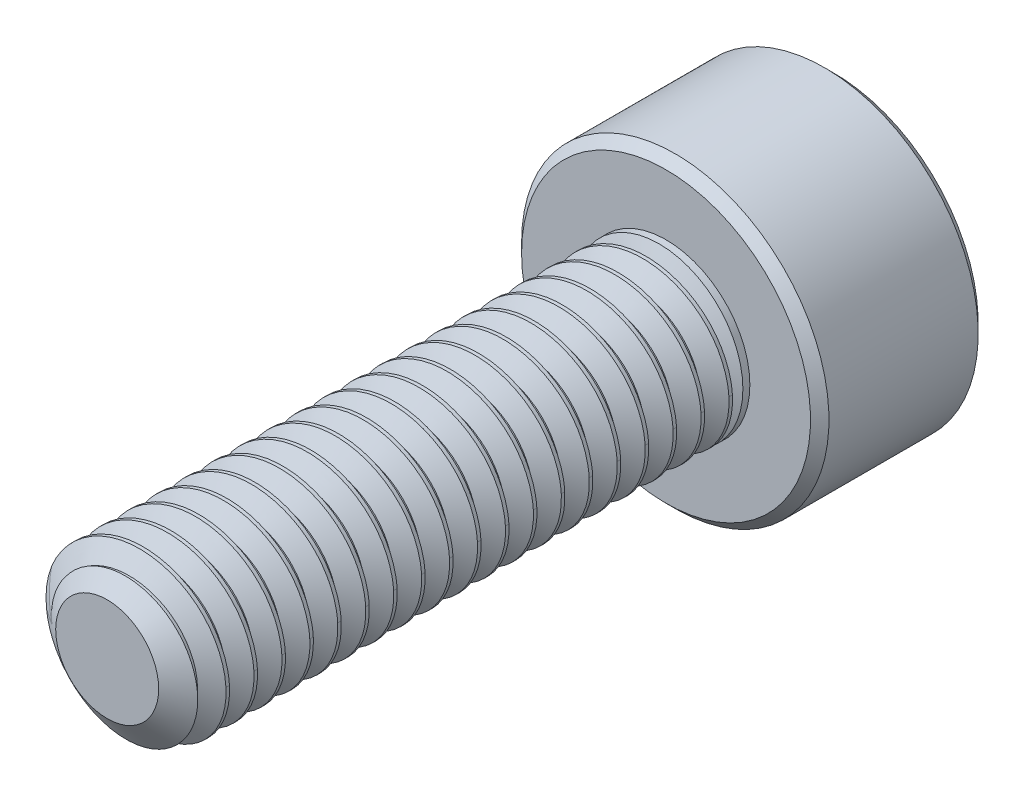
from build123d import *

# Parameters (mm, degrees)
SKETCH1_R          = 1.5
EXTRUDE1_DEPTH     = 10
CUT_SWEEP1_PITCH   = 0.5
SKETCH6_R          = 2.75
EXTRUDE2_DEPTH     = 3
CUT_EXTRUDE1_DEPTH = 1.875
CHAMFER1_SIZE      = 0.165


with BuildPart() as part:
    # Sketch1 → Extrude1 (new body)
    with BuildSketch(Plane.XY):
        Circle(SKETCH1_R)
    extrude(amount=-EXTRUDE1_DEPTH)

    # Cut-Sweep1: arcs per turn and ends read off the stored shape
    # Cut-Sweep1: the profile of Sketch3 profile screwed along a right-hand helix through 23 turns, 6 arcs to a turn; built about Z, then put on its axis
    cut_sweep1_z = Axis((0, 0, 0), (0, 0, 1))
    cut_sweep1_corners = [(1.5003, 0, -0.937673205), (1.175240474, 0, -0.75), (1.175240474, 0, -0.6875), (1.5003, 0, -0.499826795)]
    with BuildLine(mode=Mode.PRIVATE) as cut_sweep1_profile:
        Line(cut_sweep1_corners[0], cut_sweep1_corners[1])
        Line(cut_sweep1_corners[1], cut_sweep1_corners[2])
        Line(cut_sweep1_corners[2], cut_sweep1_corners[3])
        Line(cut_sweep1_corners[3], cut_sweep1_corners[0])
    cut_sweep1_cap = Face(cut_sweep1_profile.wire())
    cut_sweep1_turn_angles = [0, 30, 60, 90, 120, 150, 180, 210, 240, 270, 300, 330, 360]
    cut_sweep1_turn_weights = [1, 0.8660254037844387, 1, 0.8660254037844387, 1, 0.8660254037844387, 1, 0.8660254037844387, 1, 0.8660254037844387, 1, 0.8660254037844387, 1]
    cut_sweep1_turn_rails = [Edge.make_bspline([Vector(p[0], p[1], 0).rotate(cut_sweep1_z, cut_sweep1_turn_angles[k]) / cut_sweep1_turn_weights[k] + Vector(0, 0, p[2] + CUT_SWEEP1_PITCH * cut_sweep1_turn_angles[k] / 360) for k in range(13)], [0, 0, 0, 1, 1, 2, 2, 3, 3, 4, 4, 5, 5, 6, 6, 6], 2, cut_sweep1_turn_weights) for p in cut_sweep1_corners]
    cut_sweep1_turn_sides = [Face.make_surface_from_curves(cut_sweep1_turn_rails[p[0]], cut_sweep1_turn_rails[p[1]]) for p in [(0, 1), (1, 2), (2, 3), (3, 0)]]
    cut_sweep1 = Plane(origin=(0, 0, 0), x_dir=(0, 1, 0), z_dir=(0, 0, -1)) * Solid(Shell([*[p.moved(Location((0, 0, CUT_SWEEP1_PITCH * i))) for i in range(23) for p in cut_sweep1_turn_sides], cut_sweep1_cap, cut_sweep1_cap.rotate(cut_sweep1_z, 8280).moved(Location((0, 0, CUT_SWEEP1_PITCH * 8280 / 360)))]))
    add(cut_sweep1, mode=Mode.SUBTRACT)

    # Sketch4 → Cut-Revolve1 (revolve, cut)
    with BuildSketch(Plane(origin=(0, 0, 0), x_dir=(0, 0, -1), z_dir=(1, 0, 0)), mode=Mode.PRIVATE) as cut_revolve1_sk:
        Polygon((0.405251783, 1.5), (0, 0.921240474), (0, 1.5), align=None)
    revolve(cut_revolve1_sk.sketch.rotate(Axis((0, 0, 0), (0, 0, -1)), 263.352109169), axis=Axis((0, 0, 0), (0, 0, -1)), mode=Mode.SUBTRACT)

    # Sketch6 → Extrude2 (add)
    with BuildSketch(Plane(origin=(0, 0, -10), x_dir=(-1, 0, 0), z_dir=(0, 0, -1))):
        Circle(SKETCH6_R)
    extrude(amount=EXTRUDE2_DEPTH)

    # Sketch7 → Cut-Extrude1 (cut)
    with BuildSketch(Plane(origin=(0, 0, -13), x_dir=(-1, 0, 0), z_dir=(0, 0, -1))):
        Polygon((0, 1.443375673), (-1.25, 0.721687836), (-1.25, -0.721687836), (0, -1.443375673), (1.25, -0.721687836), (1.25, 0.721687836), align=None)
    extrude(amount=-CUT_EXTRUDE1_DEPTH, mode=Mode.SUBTRACT)

    # Cut-Extrude2 cone 1 section (through the dimple's axis) → Cut-Extrude2 (revolve, cut)
    with BuildSketch(Plane(origin=(0, 0, -13), x_dir=(0, 1, 0), z_dir=(1, 0, 0))):
        Polygon((0, 0), (1.443375673, 0), (0, 1.443375673), align=None)
    revolve(axis=Axis((0, 0, -13), (0, 0, 1)), mode=Mode.SUBTRACT)

    # Chamfer1
    chamfer1_edges = [part.edges().sort_by_distance(p)[0] for p in [
        (2.75, 0, -10),
        (2.75, 0, -13),
    ]]
    chamfer(chamfer1_edges, length=CHAMFER1_SIZE)

    # Sketch10 → Revolve1 (revolve)
    with BuildSketch(Plane(origin=(0, 0, 0), x_dir=(0, 0, -1), z_dir=(1, 0, 0)), mode=Mode.PRIVATE) as revolve1_sk:
        Polygon((10, 1.5), (10, 0), (9.253679656, 0), (9.875, 1.5), align=None)
    revolve(revolve1_sk.sketch.rotate(Axis((0, 0, -10), (0, 0, 1)), 270), axis=Axis((0, 0, -10), (0, 0, 1)))


solid = part.part
